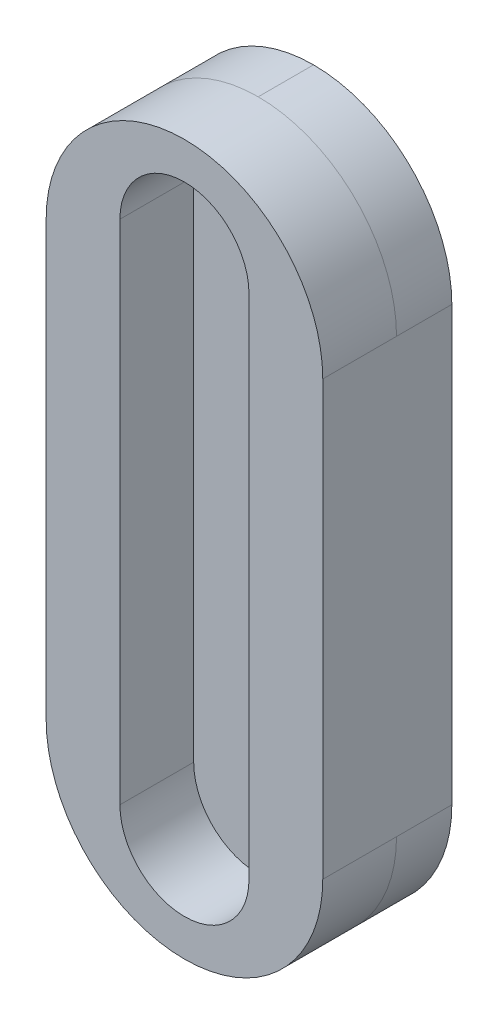
from build123d import *

# Parameters (mm, degrees)
BOSS_EXTRUDE1_DEPTH = 1
SKETCH2_W           = 7.5
SKETCH2_H           = 19.25
BOSS_EXTRUDE2_DEPTH = 0.5
BOSS_EXTRUDE3_DEPTH = 2
FILLET1_R           = 3.75


with BuildPart() as part:
    # Sketch1 → Boss-Extrude1 (new body)
    with BuildSketch(Plane.XY):
        with BuildLine():
            Line((-3.75, 8.5), (0, 8.5))
            Line((0, 8.5), (0, 18.75))
            ThreePointArc((0, 18.75), (-1.25, 20), (0, 21.25))
            Line((0, 21.25), (0, 22.75))
            ThreePointArc((0, 22.75), (-1.25, 24), (0, 25.25))
            Line((0, 25.25), (0, 27.75))
            Line((0, 27.75), (-3.75, 27.75))
            Line((-3.75, 27.75), (-3.75, 8.5))
        make_face()
        with BuildLine():
            Line((0, 18.75), (0, 8.5))
            Line((0, 8.5), (3.75, 8.5))
            Line((3.75, 8.5), (3.75, 27.75))
            Line((3.75, 27.75), (0, 27.75))
            Line((0, 27.75), (0, 25.25))
            ThreePointArc((0, 25.25), (0.883883476, 24.883883476), (1.25, 24))
            ThreePointArc((1.25, 24), (0.883883476, 23.116116524), (0, 22.75))
            Line((0, 22.75), (0, 21.25))
            ThreePointArc((0, 21.25), (0.883883476, 20.883883476), (1.25, 20))
            ThreePointArc((1.25, 20), (0.883883476, 19.116116524), (0, 18.75))
        make_face()
    extrude(amount=BOSS_EXTRUDE1_DEPTH)

    # Sketch2 → Boss-Extrude2 (add)
    with BuildSketch(Plane.XY.offset(1)):
        with Locations((0, 18.125)):
            Rectangle(SKETCH2_W, SKETCH2_H)
    extrude(amount=BOSS_EXTRUDE2_DEPTH)

    # Sketch3 → Boss-Extrude3 (add)
    with BuildSketch(Plane.XY.offset(1.5)):
        with BuildLine():
            ThreePointArc((3.75, 24), (1.097979873, 27.585657568), (-3.107034772, 26.099722582))
            Line((-3.107034772, 26.099722582), (-1.75, 22.616666667))
            Line((-1.75, 22.616666667), (-1.75, 25))
            ThreePointArc((-1.75, 25), (0, 26.75), (1.75, 25))
            Line((1.75, 25), (1.75, 13.633333333))
            Line((1.75, 13.633333333), (3.107034772, 10.150277418))
            ThreePointArc((3.107034772, 10.150277418), (3.585657568, 11.152020127), (3.75, 12.25))
            Line((3.75, 12.25), (3.75, 24))
        make_face()
        with BuildLine():
            Line((-1.75, 22.616666667), (-3.107034772, 26.099722582))
            ThreePointArc((-3.107034772, 26.099722582), (-3.585657568, 25.097979873), (-3.75, 24))
            Line((-3.75, 24), (-3.75, 12.25))
            ThreePointArc((-3.75, 12.25), (-1.097979873, 8.664342432), (3.107034772, 10.150277418))
            Line((3.107034772, 10.150277418), (1.75, 13.633333333))
            Line((1.75, 13.633333333), (1.75, 11.25))
            ThreePointArc((1.75, 11.25), (0, 9.5), (-1.75, 11.25))
            Line((-1.75, 11.25), (-1.75, 22.616666667))
        make_face()
    extrude(amount=BOSS_EXTRUDE3_DEPTH)

    # Fillet1
    fillet1_edges = [part.edges().sort_by_distance(p)[0] for p in [
        (3.75, 8.5, 0.75),
        (-3.75, 8.5, 0.75),
        (3.75, 27.75, 0.75),
        (-3.75, 27.75, 0.75),
    ]]
    fillet(fillet1_edges, radius=FILLET1_R - 0.0001)  # a hair under: the kernel refuses the full size


solid = part.part
